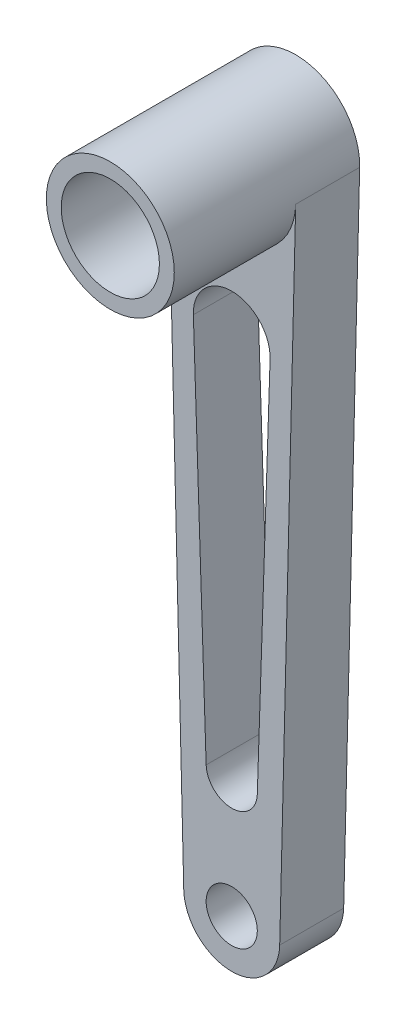
from build123d import *

# Parameters (mm, degrees)
SKETCH1_R           = 4
BOSS_EXTRUDE2_DEPTH = 10
SKETCH1_6_R         = 7.675
BOSS_EXTRUDE3_DEPTH = 28.98


with BuildPart() as part:
    # Sketch1 → Boss-Extrude2 (new body)
    with BuildSketch(Plane.XY):
        with BuildLine():
            ThreePointArc((9.996972197, -0.246062766), (5.5e-08, -10), (-9.996972195, -0.246062876))
            Line((-9.996972195, -0.246062876), (-7.497729139, -101.784547426))
            ThreePointArc((-7.497729139, -101.784547426), (1.58e-07, -109.1), (7.497729147, -101.784547111))
            Line((7.497729147, -101.784547111), (9.996972197, -0.246062766))
        make_face()
        with BuildLine():
            Line((5.996665744, -23.199999888), (3.997777167, -83.133333141))
            ThreePointArc((3.997777167, -83.133333141), (1.93e-07, -87), (-3.997777154, -83.133333527))
            Line((-3.997777154, -83.133333527), (-5.996665745, -23.199999845))
            ThreePointArc((-5.996665745, -23.199999845), (2.1e-08, -17), (5.996665744, -23.199999888))
        make_face(mode=Mode.SUBTRACT)
        with Locations((0, -101.6)):
            Circle(SKETCH1_R, mode=Mode.SUBTRACT)
    extrude(amount=BOSS_EXTRUDE2_DEPTH)

    # Sketch1<6> → Boss-Extrude3 (add)
    with BuildSketch(Plane.XY):
        with BuildLine():
            ThreePointArc((10, 0), (-0.123040752, 9.99924302), (-9.996972195, -0.246062876))
            ThreePointArc((-9.996972195, -0.246062876), (5.5e-08, -10), (9.996972197, -0.246062766))
            ThreePointArc((9.996972197, -0.246062766), (9.999243021, -0.123040697), (10, 0))
        make_face()
        Circle(SKETCH1_6_R, mode=Mode.SUBTRACT)
    extrude(amount=BOSS_EXTRUDE3_DEPTH)


solid = part.part
